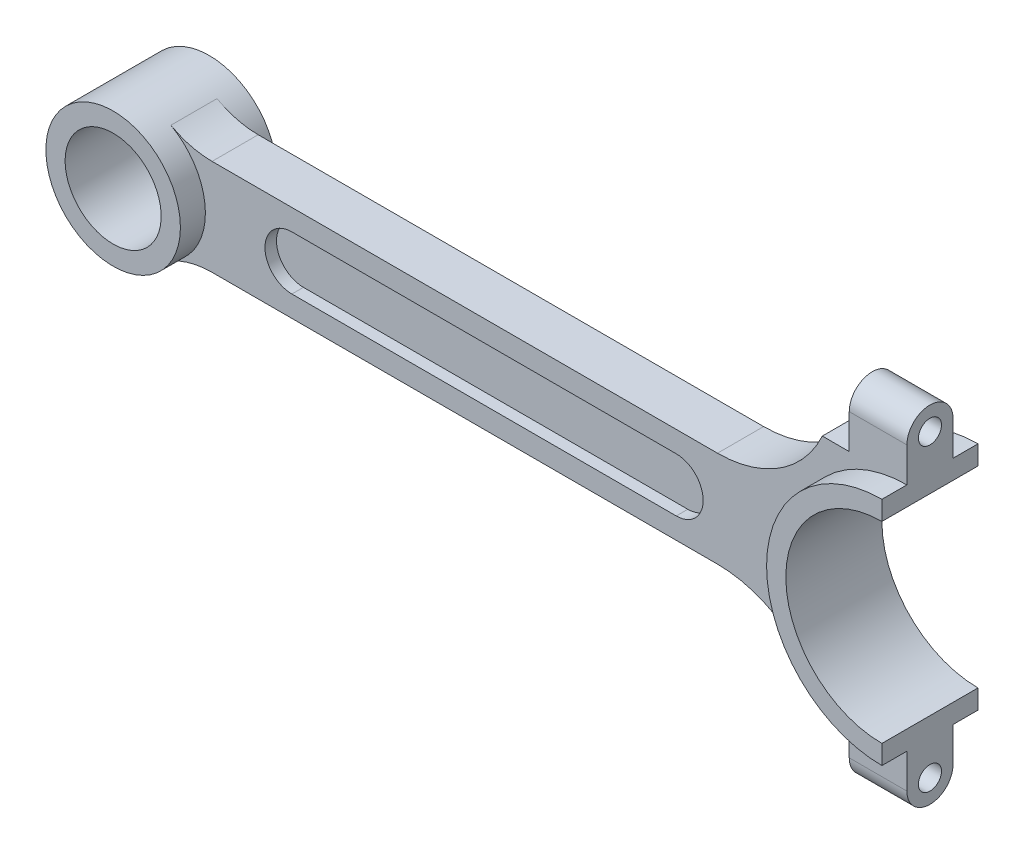
from build123d import *

# Parameters (mm, degrees)
SKETCH1_R             = 444.5
SKETCH1_R_2           = 317.5
BOSS_EXTRUDE1_DEPTH   = 317.5
BOSS_EXTRUDE1_2_DEPTH = 317.5
BOSS_EXTRUDE2_DEPTH   = 152.4
FILLET1_R             = 558.8
FILLET2_R             = 762
SKETCH4_R             = 76.2
BOSS_EXTRUDE3_DEPTH   = 381
CUT_EXTRUDE1_DEPTH    = 76.2


with BuildPart() as part:
    # Sketch1 → Boss-Extrude1 (new, symmetric)
    with BuildSketch(Plane.XY):
        with Locations(Location((0, 0, 0), (0, 0, 180))):
            Circle(SKETCH1_R)
        with Locations(Location((0, 0, 0), (0, 0, 180))):
            Circle(SKETCH1_R_2, mode=Mode.SUBTRACT)
    extrude(amount=BOSS_EXTRUDE1_DEPTH, both=True)



with BuildPart() as body_2:
    # Sketch1 → Boss-Extrude1 2 (new, symmetric)
    with BuildSketch(Plane.XY):
        with BuildLine():
            Line((5080, 762), (5080, 635))
            ThreePointArc((5080, 635), (4445, 0), (5080, -635))
            Line((5080, -635), (5080, -762))
            ThreePointArc((5080, -762), (4318, 0), (5080, 762))
        make_face()
    extrude(amount=BOSS_EXTRUDE1_2_DEPTH, both=True)


with BuildPart() as part_1:
    add(part.part)

    add(body_2.part)  # Boss-Extrude2 merges body 2
    # Sketch2 → Boss-Extrude2 (add, symmetric)
    with BuildSketch(Plane.XY):
        with BuildLine():
            Line((311.085197333, 317.5), (4318, 317.5))
            Line((4318, 317.5), (4521.2, 762))
            Line((4521.2, 762), (5080, 762))
            ThreePointArc((5080, 762), (4318, 0), (5080, -762))
            Line((5080, -762), (4521.2, -762))
            Line((4521.2, -762), (4318, -317.5))
            Line((4318, -317.5), (311.085197333, -317.5))
            ThreePointArc((311.085197333, -317.5), (444.5, 0), (311.085197333, 317.5))
        make_face()
    extrude(amount=BOSS_EXTRUDE2_DEPTH, both=True)

    # Fillet1
    fillet1_edges = [part_1.edges().sort_by_distance(p)[0] for p in [
        (311.085197333, 317.5, 0),
        (311.085197333, -317.5, 0),
    ]]
    fillet(fillet1_edges, radius=FILLET1_R)

    # Fillet2
    # the kernel refuses this fillet: 762 mm, written as the material it adds along each edge
    with BuildSketch(Plane(origin=(4318, -317.5, -152.4), x_dir=(-1, 0, 0), z_dir=(0, 0, 1))) as fillet2_piece_1_section:
        with BuildLine():
            CenterArc((FILLET2_R * 0.642393223137, FILLET2_R), FILLET2_R, 204.567171321, 65.432828679)
            Line((-FILLET2_R * 0.267081252449, FILLET2_R * 0.584240239732), (0, 0))
            Line((0, 0), (FILLET2_R * 0.642393223137, 0))
        make_face()
    fillet2_piece_1 = extrude(amount=304.8, mode=Mode.PRIVATE)
    fillet2_piece_1 = split(fillet2_piece_1, bisect_by=Plane(origin=(4255.635899042, -762, 0), z_dir=(0, 1, 0)), keep=Keep.TOP, mode=Mode.PRIVATE)
    add(fillet2_piece_1)
    with BuildSketch(Plane(origin=(4318, 317.5, 152.4), x_dir=(0.4157597602677956, 0.9094744755857996, 0), z_dir=(0, 0, -1))) as fillet2_piece_2_section:
        with BuildLine():
            CenterArc((FILLET2_R * 0.642393223137, -FILLET2_R), FILLET2_R, 90, 65.432828679)
            Line((-FILLET2_R * 0.267081252449, -FILLET2_R * 0.584240239732), (0, 0))
            Line((0, 0), (FILLET2_R * 0.642393223137, 0))
        make_face()
    fillet2_piece_2 = extrude(amount=304.8, mode=Mode.PRIVATE)
    fillet2_piece_2 = split(fillet2_piece_2, bisect_by=Plane(origin=(4255.635899042, 762, 0), z_dir=(0, -1, 0)), keep=Keep.TOP, mode=Mode.PRIVATE)
    add(fillet2_piece_2)

    # Sketch4 → Boss-Extrude3 (add)
    with BuildSketch(Plane(origin=(5080, 0, 0), x_dir=(0, 0, -1), z_dir=(1, 0, 0))):
        with BuildLine():
            Line((152.4, 990.6), (152.4, 762))
            Line((152.4, 762), (-152.4, 762))
            Line((-152.4, 762), (-152.4, 990.6))
            ThreePointArc((-152.4, 990.6), (0, 1143), (152.4, 990.6))
        make_face()
        with Locations((0, 990.6)):
            Circle(SKETCH4_R, mode=Mode.SUBTRACT)
    boss_extrude3 = extrude(amount=-BOSS_EXTRUDE3_DEPTH)

    # Mirror1: Boss-Extrude3 across plane
    add(boss_extrude3.mirror(Plane.ZX))

    # Sketch5 → Cut-Extrude1 (cut)
    with BuildSketch(Plane.XY.offset(152.4)):
        with BuildLine():
            Line((3556, -177.8), (1016, -177.8))
            ThreePointArc((1016, -177.8), (838.2, 0), (1016, 177.8))
            Line((1016, 177.8), (3556, 177.8))
            ThreePointArc((3556, 177.8), (3733.8, 0), (3556, -177.8))
        make_face()
    cut_extrude1 = extrude(amount=-CUT_EXTRUDE1_DEPTH, mode=Mode.SUBTRACT)

    # Mirror2: Cut-Extrude1 across plane
    add(cut_extrude1.mirror(Plane.XY), mode=Mode.SUBTRACT)


solid = part_1.part
